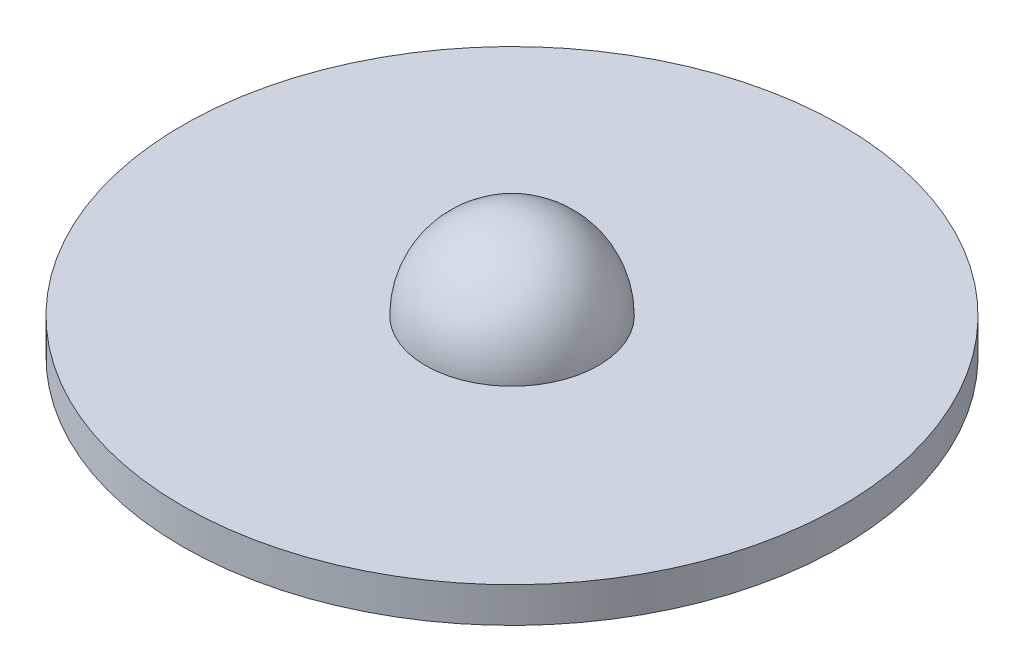
from build123d import *

# Parameters (mm, degrees)
REVOLVE_1_ANGLE = 180
SKETCH_6_W      = 8
SKETCH_6_H      = 0.856193899
SKETCH_7_W      = 7.9
SKETCH_7_H      = 0.752512397


with BuildPart() as part:
    # 草图1 → 旋转1 (revolve)
    with BuildSketch(Plane(origin=(0, 0, 0), x_dir=(1, 0, 0), z_dir=(0, 1, 0))):
        with BuildLine():
            Line((0, 2.1), (0, -2.1))
            ThreePointArc((0, -2.1), (2.1, 0), (0, 2.1))
        make_face()
    revolve(axis=Axis((0, 0, -2.1), (0, 0, 1)), revolution_arc=REVOLVE_1_ANGLE)

    # 草图6 → 旋转2 (revolve)
    with BuildSketch(Plane(origin=(0, 0, 0), x_dir=(0, 0, -1), z_dir=(1, 0, 0))):
        with Locations((4, -0.42809695)):
            Rectangle(SKETCH_6_W, SKETCH_6_H)
    revolve(axis=Axis((0, 0, 0), (0, -1, 0)))

    # 草图7 → 切除-旋转2 (revolve, cut)
    with BuildSketch(Plane(origin=(0, 0, 0), x_dir=(0, 0, -1), z_dir=(1, 0, 0))):
        with Locations((3.95, -0.479937701)):
            Rectangle(SKETCH_7_W, SKETCH_7_H)
    revolve(axis=Axis((0, -0.103681502, 0), (0, -1, 0)), mode=Mode.SUBTRACT)


solid = part.part
